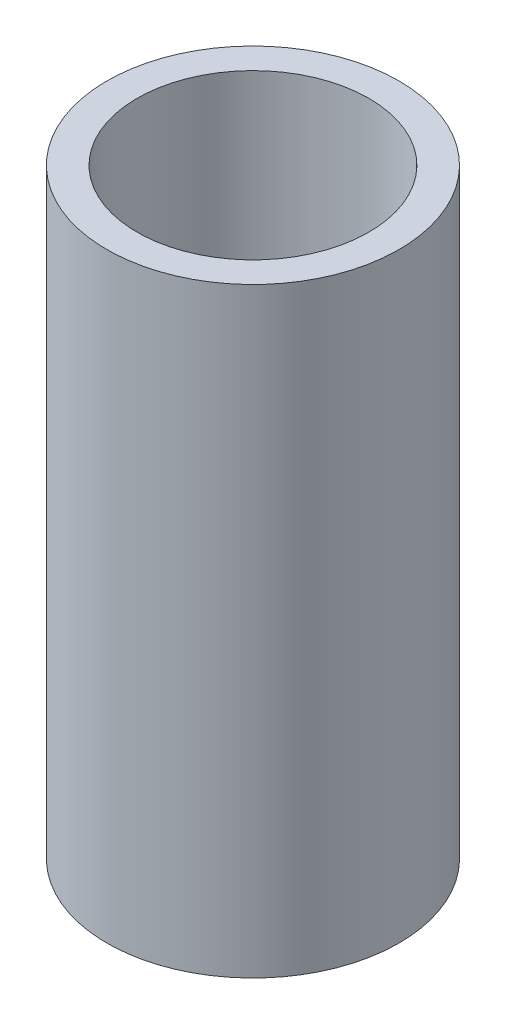
from build123d import *

# Parameters (mm, degrees)
SKETCH1_R           = 4
SKETCH1_R_2         = 3.175
BOSS_EXTRUDE1_DEPTH = 16.448


with BuildPart() as part:
    # Sketch1 → Boss-Extrude1 (new body)
    with BuildSketch(Plane(origin=(0, 0, 0), x_dir=(1, 0, 0), z_dir=(0, 1, 0))):
        Circle(SKETCH1_R)
        Circle(SKETCH1_R_2, mode=Mode.SUBTRACT)
    extrude(amount=BOSS_EXTRUDE1_DEPTH)


solid = part.part
